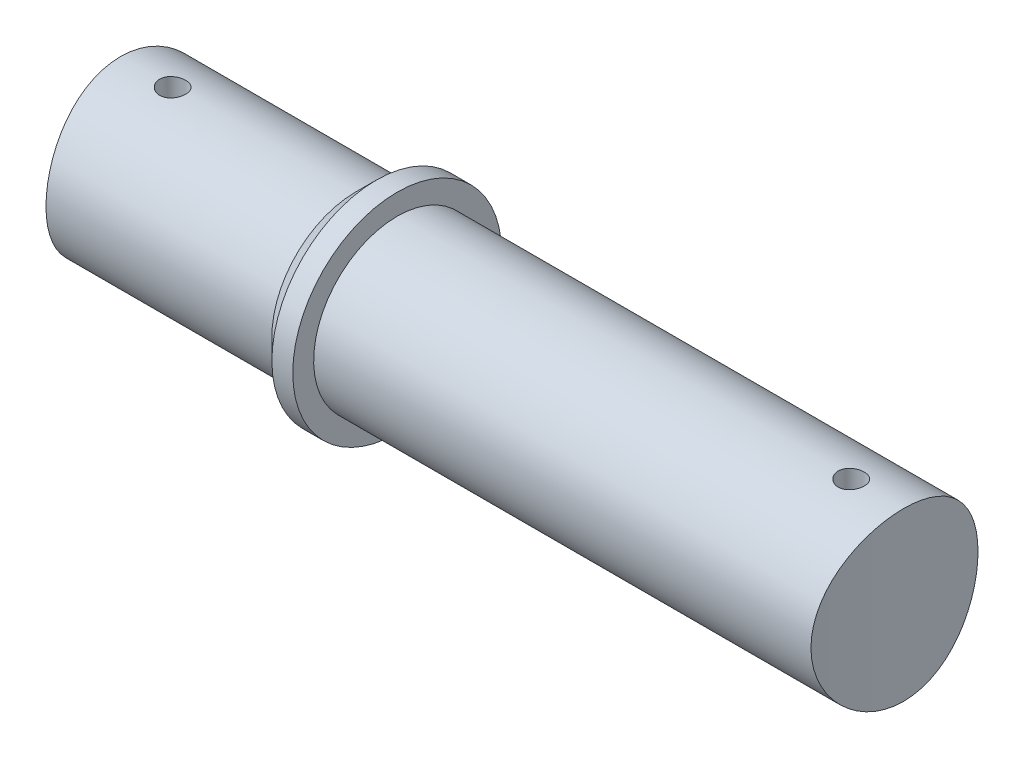
from build123d import *

# Parameters (mm, degrees)
SKETCH1_3_W             = 0.625
SKETCH1_3_H             = 4.625
SKETCH1_4_W             = 0.625
SKETCH1_4_H             = 4.625
CUT_EXTRUDE1_DEPTH      = 20.584751858
CUT_EXTRUDE1_DEPTH_BACK = 20.584751858


with BuildPart() as part:
    # Sketch1 → Revolve1 (revolve)
    with BuildSketch(Plane.XY):
        Polygon((-18.75, 4), (-18.75, 0), (-16.875, 0), (-16.875, 0.625), (16.875, 0.625), (16.875, 0), (18.75, 0), (18.75, 4), align=None)
    revolve(axis=Axis((0, 0, 0), (-1, 0, 0)))

    # Sketch1<3> → Cut-Revolve1 (revolve, cut)
    with BuildSketch(Plane.XY):
        with Locations((-0.3125, -1.6875)):
            Rectangle(SKETCH1_3_W, SKETCH1_3_H)
    revolve(axis=Axis((0, 0, 0), (0, 1, 0)), mode=Mode.SUBTRACT)

    # Sketch1<4> → Cut-Revolve2 (revolve, cut)
    with BuildSketch(Plane.XY):
        with Locations((16.5625, 1.6875)):
            Rectangle(SKETCH1_4_W, SKETCH1_4_H)
    cut_revolve2 = revolve(axis=Axis((16.25, -0.625, 0), (0, -1, 0)), mode=Mode.SUBTRACT)

    # Mirror1: Cut-Revolve2 across plane
    add(cut_revolve2.mirror(Plane(origin=(0, 0, 0), x_dir=(0, 0, 1), z_dir=(1, 0, 0))), mode=Mode.SUBTRACT)

    # Sketch2 → Cut-Extrude1 (cut, two sides: drawn at the far end of the back side and taken through both)
    with BuildSketch(Plane(origin=(0, 0, 0), x_dir=(1, 0, 0), z_dir=(0, 1, 0)).offset(-CUT_EXTRUDE1_DEPTH_BACK)):
        with BuildLine():
            Line((-18.318365102, 4), (-18.75, 4))
            Line((-18.75, 4), (-18.75, 0))
            ThreePointArc((-18.75, 0), (-18.641778961, 2.011610591), (-18.318365102, 4))
        make_face()
        with BuildLine():
            ThreePointArc((-18.318365102, -4), (-18.641778961, -2.011610591), (-18.75, 0))
            Line((-18.75, 0), (-18.75, -4))
            Line((-18.75, -4), (-18.318365102, -4))
        make_face()
        with BuildLine():
            Line((18.318365102, -4), (18.75, -4))
            Line((18.75, -4), (18.75, 0))
            ThreePointArc((18.75, 0), (18.641778961, -2.011610591), (18.318365102, -4))
        make_face()
        with BuildLine():
            ThreePointArc((18.318365102, 4), (18.641778961, 2.011610591), (18.75, 0))
            Line((18.75, 0), (18.75, 4))
            Line((18.75, 4), (18.318365102, 4))
        make_face()
    extrude(amount=CUT_EXTRUDE1_DEPTH + CUT_EXTRUDE1_DEPTH_BACK, mode=Mode.SUBTRACT)

    # Sketch3 → Revolve2 (revolve)
    with BuildSketch(Plane.XY):
        Polygon((-5.5, 4), (-5.5, 5), (-6.5, 5), (-7.5, 4), align=None)
    revolve(axis=Axis((0, 0, 0), (-1, 0, 0)))


solid = part.part
